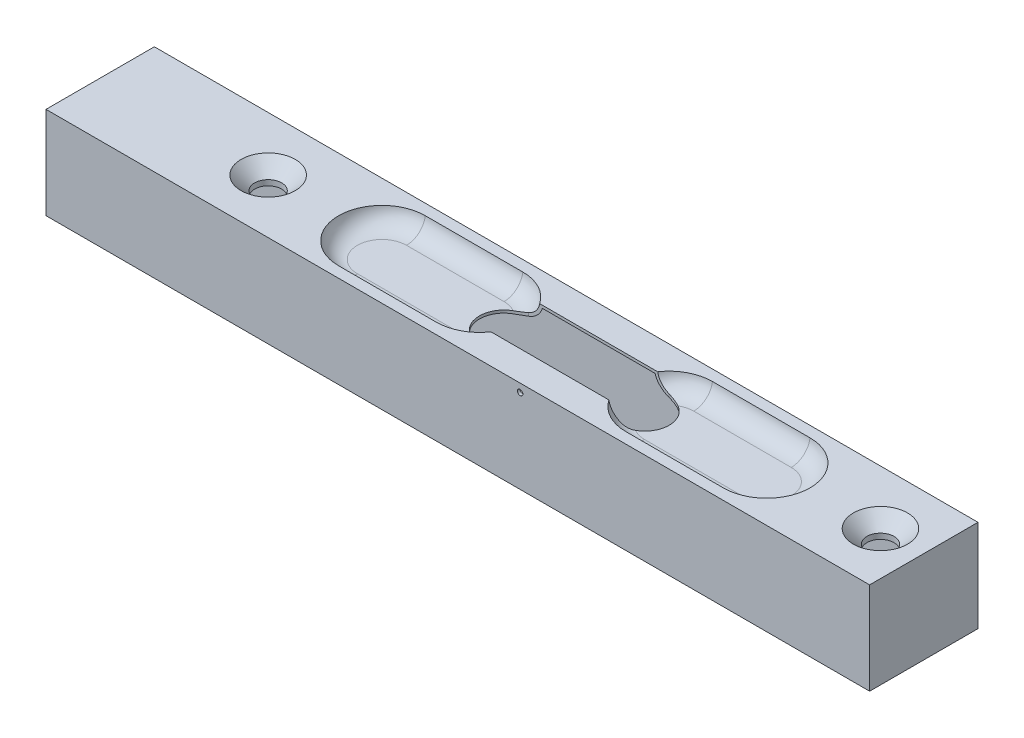
from build123d import *

# Parameters (mm, degrees)
SKETCH1_W               = 152
SKETCH1_H               = 20
BOSS_EXTRUDE1_DEPTH     = 17
SKETCH2_R               = 2.5
CUT_EXTRUDE1_DEPTH      = 3
FILLET1_R               = 3.5
CHAMFER1_SIZE           = 2.5
SHELL1_T                = -0.5
SKETCH3_R               = 2.5
CUT_EXTRUDE2_DEPTH      = 79.51751397
CUT_EXTRUDE3_REACH      = 155.274
SKETCH4_R               = 5.25
CUT_EXTRUDE4_DEPTH      = 79.517513991
CUT_EXTRUDE4_DEPTH_BACK = 79.517513991
SKETCH5_R               = 0.5


with BuildPart() as part:
    # Sketch1 → Boss-Extrude1 (new body)
    with BuildSketch(Plane(origin=(0, 0, 0), x_dir=(1, 0, 0), z_dir=(0, 1, 0))):
        Rectangle(SKETCH1_W, SKETCH1_H)
    extrude(amount=BOSS_EXTRUDE1_DEPTH)

    # Sketch2 → Cut-Extrude1 (cut)
    with BuildSketch(Plane(origin=(0, 17, 0), x_dir=(1, 0, 0), z_dir=(0, 1, 0))):
        with Locations(Location((68, 0, 0), (0, 0, 270))):
            Circle(SKETCH2_R)
        with Locations(Location((-45, 0, 0), (0, 0, 270))):
            Circle(SKETCH2_R)
        with BuildLine():
            Line((-24, 8), (-6, 8))
            ThreePointArc((-6, 8), (2, 0), (-6, -8))
            Line((-6, -8), (-24, -8))
            ThreePointArc((-24, -8), (-32, 0), (-24, 8))
        make_face()
        with BuildLine():
            Line((29, 8), (47, 8))
            ThreePointArc((47, 8), (55, 0), (47, -8))
            Line((47, -8), (29, -8))
            ThreePointArc((29, -8), (21, 0), (29, 8))
        make_face()
    extrude(amount=-CUT_EXTRUDE1_DEPTH, mode=Mode.SUBTRACT)

    # Fillet1
    # the kernel refuses this fillet: 3.5 mm, written as the material it adds along each edge
    with BuildSketch(Plane(origin=(47, 14, 0), x_dir=(0, 0, -1), z_dir=(-1, 0, 0))) as fillet1_piece_1:
        with BuildLine():
            CenterArc((4.535898385, -3.5), FILLET1_R, 8.213210702, 81.786789298)
            Line((4.535898385, 0), (4.535898385, 0.07))
            Line((4.535898385, 0.07), (8, 0.07))
            Line((8, 0.07), (8.07, 0))
            ThreePointArc((8.07, 0), (8.07, -1.5), (8.069282032, -2.99))
            Line((8.069282032, -2.99), (8, -3))
        make_face()
    revolve(axis=Axis((47, 14, 0), (0, -1, 0)), revolution_arc=180)
    with BuildSketch(Plane(origin=(47, 14, 8), x_dir=(0, 1, 0), z_dir=(-1, 0, 0)), Plane(origin=(-6, 14, 8), x_dir=(0, 1, 0), z_dir=(-1, 0, 0)), Plane(origin=(29, 14, -8), x_dir=(0, 1, 0), z_dir=(1, 0, 0)), Plane(origin=(-24, 14, -8), x_dir=(0, 1, 0), z_dir=(1, 0, 0))) as fillet1_piece_2:
        with BuildLine():
            CenterArc((3.5, 3.464101615), FILLET1_R, 180, 81.786789298)
            Line((0, 3.464101615), (-0.07, 3.464101615))
            Line((-0.07, 3.464101615), (-0.07, 0))
            Line((-0.07, 0), (0, -0.07))
            ThreePointArc((0, -0.07), (1.5, -0.07), (2.99, -0.069282032))
            Line((2.99, -0.069282032), (3, 0))
        make_face()
    extrude(amount=18)
    with BuildSketch(Plane(origin=(29, 14, 0), x_dir=(0, 0, 1), z_dir=(1, 0, 0))) as fillet1_piece_3:
        with BuildLine():
            CenterArc((4.535898385, -3.5), FILLET1_R, 8.213210702, 81.786789298)
            Line((4.535898385, 0), (4.535898385, 0.07))
            Line((4.535898385, 0.07), (8, 0.07))
            Line((8, 0.07), (8.07, 0))
            ThreePointArc((8.07, 0), (8.07, -1.5), (8.069282032, -2.99))
            Line((8.069282032, -2.99), (8, -3))
        make_face()
    revolve(axis=Axis((29, 14, 0), (0, -1, 0)), revolution_arc=180)
    with BuildSketch(Plane(origin=(-6, 14, 0), x_dir=(0, 0, -1), z_dir=(-1, 0, 0))) as fillet1_piece_4:
        with BuildLine():
            CenterArc((4.535898385, -3.5), FILLET1_R, 8.213210702, 81.786789298)
            Line((4.535898385, 0), (4.535898385, 0.07))
            Line((4.535898385, 0.07), (8, 0.07))
            Line((8, 0.07), (8.07, 0))
            ThreePointArc((8.07, 0), (8.07, -1.5), (8.069282032, -2.99))
            Line((8.069282032, -2.99), (8, -3))
        make_face()
    revolve(axis=Axis((-6, 14, 0), (0, -1, 0)), revolution_arc=180)
    with BuildSketch(Plane(origin=(-24, 14, 0), x_dir=(0, 0, 1), z_dir=(1, 0, 0))) as fillet1_piece_5:
        with BuildLine():
            CenterArc((4.535898385, -3.5), FILLET1_R, 8.213210702, 81.786789298)
            Line((4.535898385, 0), (4.535898385, 0.07))
            Line((4.535898385, 0.07), (8, 0.07))
            Line((8, 0.07), (8.07, 0))
            ThreePointArc((8.07, 0), (8.07, -1.5), (8.069282032, -2.99))
            Line((8.069282032, -2.99), (8, -3))
        make_face()
    revolve(axis=Axis((-24, 14, 0), (0, -1, 0)), revolution_arc=180)

    # Chamfer1
    chamfer1_edges = [part.edges().sort_by_distance(p)[0] for p in [
        (68, 17, -2.5),
        (-45, 17, -2.5),
    ]]
    chamfer(chamfer1_edges, length=CHAMFER1_SIZE)

    # Shell1
    shell1_openings = [part.faces().sort_by_distance(p)[0] for p in [
        (0, 0, 0),
    ]]
    offset(amount=SHELL1_T, openings=shell1_openings, kind=Kind.INTERSECTION)

    # Sketch3 → Cut-Extrude2 (cut, through all)
    with BuildSketch(Plane(origin=(0, 0, 0), x_dir=(1, 0, 0), z_dir=(0, 1, 0))):
        with Locations(Location((-45, 0, 0), (0, 0, 270))):
            Circle(SKETCH3_R)
        with Locations(Location((68, 0, 0), (0, 0, 270))):
            Circle(SKETCH3_R)
        with BuildLine():
            Line((-1.5, 4.5), (24.5, 4.5))
            ThreePointArc((24.5, 4.5), (29, 0), (24.5, -4.5))
            Line((24.5, -4.5), (-1.5, -4.5))
            ThreePointArc((-1.5, -4.5), (-6, 0), (-1.5, 4.5))
        make_face()
    extrude(amount=CUT_EXTRUDE2_DEPTH, mode=Mode.SUBTRACT)

    # Sketch4 → Cut-Extrude3 (cut, up to next)
    with BuildSketch(Plane.ZY.offset(76), mode=Mode.PRIVATE) as cut_extrude3_sk1:
        with Locations((0, 8.5)):
            Circle(SKETCH4_R)
    cut_extrude3_tool1 = extrude(cut_extrude3_sk1.sketch, amount=-CUT_EXTRUDE3_REACH, mode=Mode.PRIVATE) & part.part
    add(cut_extrude3_tool1.solids().sort_by_distance((-76, 8.5, 0))[0], mode=Mode.SUBTRACT)

    # Sketch5 → Cut-Extrude4 (cut, two sides: drawn at the far end of the back side and taken through both)
    with BuildSketch(Plane.XY.offset(-CUT_EXTRUDE4_DEPTH_BACK)):
        with Locations((11.5, 15.5)):
            Circle(SKETCH5_R)
    extrude(amount=CUT_EXTRUDE4_DEPTH + CUT_EXTRUDE4_DEPTH_BACK, mode=Mode.SUBTRACT)


solid = part.part
